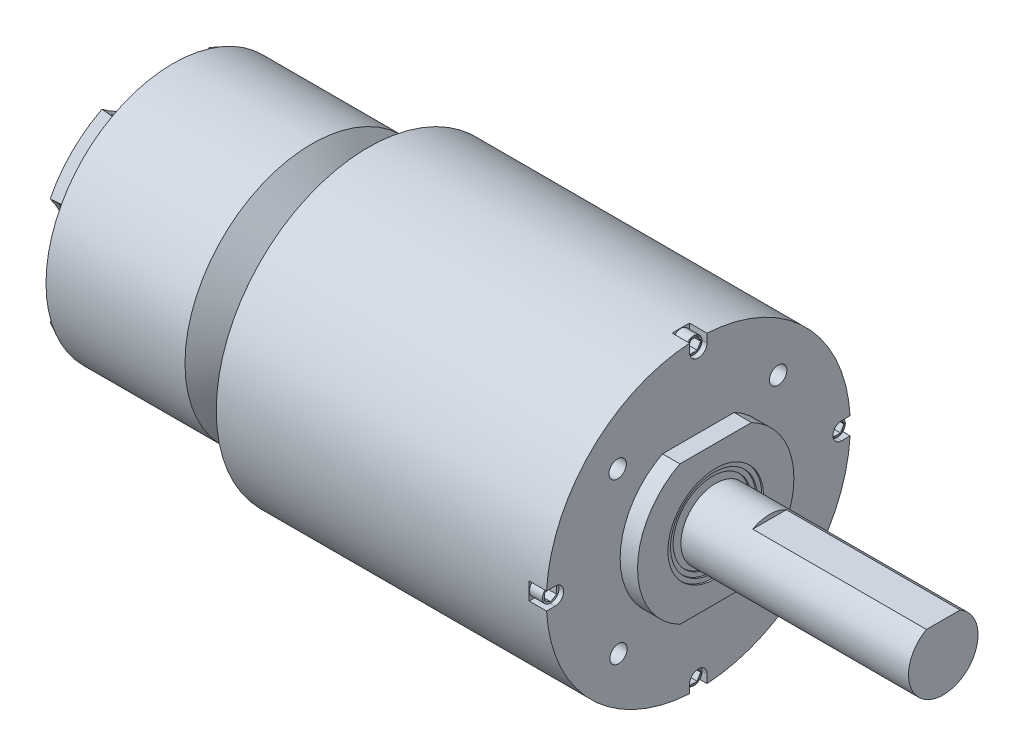
from build123d import *
from build123d.topology import SkipClean

# Parameters (mm, degrees)
BOSS_EXTRUDE1_DEPTH = 2
SKETCH6_R           = 4.5
CUT_EXTRUDE7_DEPTH  = 0.6
SKETCH8_R           = 5
CUT_EXTRUDE8_DEPTH  = 0.4
SKETCH9_R           = 5.5
CUT_EXTRUDE9_DEPTH  = 0.2
CUT_EXTRUDE11_DEPTH = 20
SKETCH11_R          = 1
CUT_EXTRUDE13_DEPTH = 4
CIRPATTERN2_COUNT   = 4
CUT_EXTRUDE20_DEPTH = 4
SKETCH13_R          = 0.95
BOSS_EXTRUDE2_DEPTH = 3.5
CUT_EXTRUDE21_DEPTH = 1
FILLET2_R           = 0.05
BOSS_EXTRUDE7_DEPTH = 2
CUT_EXTRUDE23_DEPTH = 2
SKETCH17_R          = 0.95
BOSS_EXTRUDE8_DEPTH = 1.5
SKETCH18_R          = 0.8
CUT_EXTRUDE24_DEPTH = 1
SKETCH20_R          = 0.8
BOSS_EXTRUDE9_DEPTH = 1
CUT_EXTRUDE27_DEPTH = 1
FILLET3_R           = 0.05
SKETCH22_R          = 10
CUT_EXTRUDE28_DEPTH = 2
SKETCH23_R          = 1
CUT_EXTRUDE29_DEPTH = 2


with BuildPart() as part:
    # Sketch1 → Revolve2 (revolve)
    with BuildSketch(Plane.XY, mode=Mode.PRIVATE) as revolve2_sk:
        Polygon((0, 1.6), (0, 0), (3, 0), (3, 13.6), (20, 13.6), (23.176928962, 9.6), (23.176928962, 0), (26, 0), (26.5, 0), (26.5, 1.6), (26, 1.6), (26, 4), (24, 4), (24, 9.6), (20, 14.6), (4, 14.6), (2, 13.6), (2, 5.6), (1, 5.6), (1, 1.6), align=None)
        Polygon((26.5, 1.6), (26.5, 0), (27.5, 0), (28, 0), (28, 16), (63, 16), (63, 0), (92.7, 0), (92.7, 4), (66.7, 4), (66.5, 4), (66.5, 5), (66.5, 5.6), (64.5, 5.6), (64.5, 17.5), (26.5, 17.5), align=None)
    revolve(revolve2_sk.sketch.rotate(Axis((0, 0, 0), (1, 0, 0)), 90), axis=Axis((0, 0, 0), (1, 0, 0)))

    # Sketch5 → Boss-Extrude1 (add)
    with BuildSketch(Plane(origin=(64.5, 0, 0), x_dir=(0, 0, -1), z_dir=(1, 0, 0))):
        with BuildLine():
            Line((0, 8), (0, 5.6))
            ThreePointArc((0, 5.6), (3.959797975, 3.959797975), (5.6, 0))
            ThreePointArc((5.6, 0), (3.959797975, -3.959797975), (0, -5.6))
            Line((0, -5.6), (0, -8))
            Line((0, -8), (4.123105626, -8))
            ThreePointArc((4.123105626, -8), (9, 0), (4.123105626, 8))
            Line((4.123105626, 8), (0, 8))
        make_face()
        with BuildLine():
            ThreePointArc((0, -5.6), (-5.6, 0), (0, 5.6))
            Line((0, 5.6), (0, 8))
            Line((0, 8), (-4.123105626, 8))
            ThreePointArc((-4.123105626, 8), (-9, 0), (-4.123105626, -8))
            Line((-4.123105626, -8), (0, -8))
            Line((0, -8), (0, -5.6))
        make_face()
    extrude(amount=BOSS_EXTRUDE1_DEPTH)

    # Sketch6 → Cut-Extrude7 (cut)
    with BuildSketch(Plane(origin=(66.5, 0, 0), x_dir=(0, 0, -1), z_dir=(1, 0, 0))):
        Circle(SKETCH6_R)
    extrude(amount=-CUT_EXTRUDE7_DEPTH, mode=Mode.SUBTRACT)


with BuildPart() as cut_extrude7_piece_1:
    # of the separate pieces the step leaves, piece 1, a body of its own (cut_extrude7_pieces)
    add(part.part.solids().sort_by_distance((66.5, -8, -4.123105626))[0])

    # Sketch8 → Cut-Extrude8 (cut)
    with BuildSketch(Plane(origin=(66.5, 0, 0), x_dir=(0, 0, -1), z_dir=(1, 0, 0))):
        Circle(SKETCH8_R)
    extrude(amount=-CUT_EXTRUDE8_DEPTH, mode=Mode.SUBTRACT)

    # Sketch9 → Cut-Extrude9 (cut)
    with BuildSketch(Plane(origin=(66.5, 0, 0), x_dir=(0, 0, -1), z_dir=(1, 0, 0))):
        Circle(SKETCH9_R)
    extrude(amount=-CUT_EXTRUDE9_DEPTH, mode=Mode.SUBTRACT)

    # Sketch11 → Cut-Extrude13 (cut)
    with BuildSketch(Plane(origin=(64.5, 0, 0), x_dir=(0, 0, -1), z_dir=(1, 0, 0))):
        with Locations((9.192388155, 9.192388155)):
            Circle(SKETCH11_R)
    cut_extrude13 = extrude(amount=-CUT_EXTRUDE13_DEPTH, mode=Mode.SUBTRACT)

    # CirPattern2: Cut-Extrude13 ×4 about axis
    cirpattern2_axis = Axis((0, -0.098886495, 0), (1, 0, 0))
    for i in range(1, CIRPATTERN2_COUNT):
        add(cut_extrude13.rotate(cirpattern2_axis, i * 360 / CIRPATTERN2_COUNT), mode=Mode.SUBTRACT)

    # Sketch12 → Cut-Extrude20 (cut)
    with BuildSketch(Plane(origin=(64.5, 0, 0), x_dir=(0, 0, -1), z_dir=(1, 0, 0))):
        with BuildLine():
            Line((-1, 17.47140521), (-1, 16.5))
            ThreePointArc((-1, 16.5), (0, 15.5), (1, 16.5))
            Line((1, 16.5), (1, 17.47140521))
            ThreePointArc((1, 17.47140521), (0, 17.5), (-1, 17.47140521))
        make_face()
    extrude(amount=-CUT_EXTRUDE20_DEPTH, mode=Mode.SUBTRACT)

    # Sketch13 → Boss-Extrude2 (add)
    with BuildSketch(Plane(origin=(60.5, 0, 0), x_dir=(0, 0, -1), z_dir=(1, 0, 0))):
        with Locations(Location((0, 16.5, 0), (0, 0, 213.170285224))):
            Circle(SKETCH13_R)
    extrude(amount=BOSS_EXTRUDE2_DEPTH)

    # Sketch14 → Cut-Extrude21 (cut)
    with BuildSketch(Plane(origin=(64, 0, 0), x_dir=(0, 0, -1), z_dir=(1, 0, 0))):
        Polygon((-0.4, 17.192820323), (0.4, 17.192820323), (0.8, 16.5), (0.4, 15.807179677), (-0.4, 15.807179677), (-0.8, 16.5), align=None)
    extrude(amount=-CUT_EXTRUDE21_DEPTH, mode=Mode.SUBTRACT)

    # Fillet2
    fillet2_edges = [cut_extrude7_piece_1.edges().sort_by_distance(p)[0] for p in [
        (64, 17.019772727, -0.79519577),
        (64, 16.846410162, 0.6),
        (64, 16.153589838, 0.6),
        (64, 15.807179677, 0),
        (64, 16.153589838, -0.6),
        (64, 16.846410162, -0.6),
        (64, 17.192820323, 0),
    ]]
    fillet(fillet2_edges, radius=FILLET2_R)

    # Sketch15 → Boss-Extrude7 (add)
    with SkipClean():  # the faces are left unmerged after this step: merging them gives an invalid solid
        with BuildSketch(Plane(origin=(60.5, 0, 0), x_dir=(0, 0, -1), z_dir=(1, 0, 0))):
            with BuildLine():
                Line((-1, 17.47140521), (-1, 16.5))
                ThreePointArc((-1, 16.5), (-0.96241882, 16.22843046), (-0.85249997, 15.977272727))
                ThreePointArc((-0.85249997, 15.977272727), (-0.823849194, 15.978775689), (-0.79519577, 15.980227273))
                ThreePointArc((-0.79519577, 15.980227273), (0, 17.45), (0.79519577, 15.980227273))
                ThreePointArc((0.79519577, 15.980227273), (0.823849194, 15.978775689), (0.85249997, 15.977272727))
                ThreePointArc((0.85249997, 15.977272727), (0.96241882, 16.22843046), (1, 16.5))
                Line((1, 16.5), (1, 17.47140521))
                ThreePointArc((1, 17.47140521), (0, 17.5), (-1, 17.47140521))
            make_face()
        extrude(amount=BOSS_EXTRUDE7_DEPTH)

    # Sketch16 → Cut-Extrude23 (cut)
    with SkipClean():  # the faces are left unmerged after this step: merging them gives an invalid solid
        with BuildSketch(Plane(origin=(64.5, 0, 0), x_dir=(0, 0, -1), z_dir=(1, 0, 0))):
            with BuildLine():
                ThreePointArc((0.999540758, -16.46969697), (0, -16.5), (-0.999540758, -16.46969697))
                ThreePointArc((-0.999540758, -16.46969697), (-0.999885183, -16.484846745), (-1, -16.5))
                Line((-1, -16.5), (-1, -17.47140521))
                ThreePointArc((-1, -17.47140521), (0, -17.5), (1, -17.47140521))
                Line((1, -17.47140521), (1, -16.5))
                ThreePointArc((1, -16.5), (0.999885183, -16.484846745), (0.999540758, -16.46969697))
            make_face()
            with BuildLine():
                ThreePointArc((0.999540758, -16.46969697), (0, -15.5), (-0.999540758, -16.46969697))
                ThreePointArc((-0.999540758, -16.46969697), (0, -16.5), (0.999540758, -16.46969697))
            make_face()
            with BuildLine():
                ThreePointArc((16.5, 1), (16.484846745, 0.999885183), (16.46969697, 0.999540758))
                ThreePointArc((16.46969697, 0.999540758), (16.492422502, 0.5), (16.5, 0))
                ThreePointArc((16.5, 0), (16.492422502, -0.5), (16.46969697, -0.999540758))
                ThreePointArc((16.46969697, -0.999540758), (16.484846745, -0.999885183), (16.5, -1))
                Line((16.5, -1), (17.47140521, -1))
                ThreePointArc((17.47140521, -1), (17.5, 0), (17.47140521, 1))
                Line((17.47140521, 1), (16.5, 1))
            make_face()
            with BuildLine():
                ThreePointArc((16.5, 0), (16.492422502, 0.5), (16.46969697, 0.999540758))
                ThreePointArc((16.46969697, 0.999540758), (15.5, 0), (16.46969697, -0.999540758))
                ThreePointArc((16.46969697, -0.999540758), (16.492422502, -0.5), (16.5, 0))
            make_face()
            with BuildLine():
                ThreePointArc((-16.46969697, 0.999540758), (-16.484846745, 0.999885183), (-16.5, 1))
                Line((-16.5, 1), (-17.47140521, 1))
                ThreePointArc((-17.47140521, 1), (-17.5, 0), (-17.47140521, -1))
                Line((-17.47140521, -1), (-16.5, -1))
                ThreePointArc((-16.5, -1), (-16.484846745, -0.999885183), (-16.46969697, -0.999540758))
                ThreePointArc((-16.46969697, -0.999540758), (-16.5, 0), (-16.46969697, 0.999540758))
            make_face()
            with BuildLine():
                ThreePointArc((-16.46969697, -0.999540758), (-15.5, 0), (-16.46969697, 0.999540758))
                ThreePointArc((-16.46969697, 0.999540758), (-16.5, 0), (-16.46969697, -0.999540758))
            make_face()
        extrude(amount=-CUT_EXTRUDE23_DEPTH, mode=Mode.SUBTRACT)

    # Sketch17 → Boss-Extrude8 (add)
    with SkipClean():  # the faces are left unmerged after this step: merging them gives an invalid solid
        with BuildSketch(Plane(origin=(62.5, 0, 0), x_dir=(0, 0, -1), z_dir=(1, 0, 0))):
            with Locations(Location((16.5, 0, 0), (0, 0, 123.170285224))):
                Circle(SKETCH17_R)
            with Locations(Location((0, -16.5, 0), (0, 0, 146.829714776))):
                Circle(SKETCH17_R)
            with Locations(Location((-16.5, 0, 0), (0, 0, 56.829714776))):
                Circle(SKETCH17_R)
        extrude(amount=BOSS_EXTRUDE8_DEPTH)

    # Sketch18 → Cut-Extrude24 (cut)
    with SkipClean():  # the faces are left unmerged after this step: merging them gives an invalid solid
        with BuildSketch(Plane(origin=(64, 0, 0), x_dir=(0, 0, -1), z_dir=(1, 0, 0))):
            with Locations((16.5, 0)):
                Circle(SKETCH18_R)
            with Locations((0, -16.5)):
                Circle(SKETCH18_R)
            Polygon((-17.192820323, 0.4), (-16.5, 0.8), (-15.807179677, 0.4), (-15.807179677, -0.4), (-16.5, -0.8), (-17.192820323, -0.4), align=None)
        extrude(amount=-CUT_EXTRUDE24_DEPTH, mode=Mode.SUBTRACT)

    # Sketch20 → Boss-Extrude9 (add)
    with SkipClean():  # the faces are left unmerged after this step: merging them gives an invalid solid
        with BuildSketch(Plane(origin=(63, 0, 0), x_dir=(0, 0, -1), z_dir=(1, 0, 0))):
            with Locations((0, -16.5)):
                Circle(SKETCH20_R)
            with Locations((16.5, 0)):
                Circle(SKETCH20_R)
        extrude(amount=BOSS_EXTRUDE9_DEPTH)

    # Sketch21 → Cut-Extrude27 (cut)
    with SkipClean():  # the faces are left unmerged after this step: merging them gives an invalid solid
        with BuildSketch(Plane(origin=(64, 0, 0), x_dir=(0, 0, -1), z_dir=(1, 0, 0))):
            Polygon((16.9, 0.692820323), (17.3, 0), (16.9, -0.692820323), (16.1, -0.692820323), (15.7, 0), (16.1, 0.692820323), align=None)
            Polygon((0.4, -17.192820323), (-0.4, -17.192820323), (-0.8, -16.5), (-0.4, -15.807179677), (0.4, -15.807179677), (0.8, -16.5), align=None)
        extrude(amount=-CUT_EXTRUDE27_DEPTH, mode=Mode.SUBTRACT)

    # Fillet3
    # the kernel refuses this fillet: 0.05 mm, written as the material it takes off along each edge
    with BuildSketch(Plane(origin=(64, 0, -16.5), x_dir=(0, 0.8370481785251175, 0.5471291865983601), z_dir=(0, 0.5471291865983601, -0.8370481785251175))) as fillet3_piece_1:
        with BuildLine():
            CenterArc((0.95 - FILLET3_R, -FILLET3_R), FILLET3_R, 0, 90)
            Line((0.95 - FILLET3_R, 0), (0.95, 0))
            Line((0.95, 0), (0.95, -FILLET3_R))
        make_face()
    revolve(axis=Axis((64, 0, -16.5), (1, 0, 0)), mode=Mode.SUBTRACT)
    with BuildSketch(Plane(origin=(64, -16.5, 0), x_dir=(0, 0.5471291865983604, 0.8370481785251173), z_dir=(0, 0.8370481785251173, -0.5471291865983604))) as fillet3_piece_2:
        with BuildLine():
            CenterArc((0.95 - FILLET3_R, -FILLET3_R), FILLET3_R, 0, 90)
            Line((0.95 - FILLET3_R, 0), (0.95, 0))
            Line((0.95, 0), (0.95, -FILLET3_R))
        make_face()
    revolve(axis=Axis((64, -16.5, 0), (1, 0, 0)), mode=Mode.SUBTRACT)
    with BuildSketch(Plane(origin=(64, 0.108253175, -17.3625), x_dir=(0, -0.5000000000000093, -0.8660254037844333), z_dir=(0, -0.8660254037844334, 0.5000000000000093))) as fillet3_piece_3_section:
        with BuildLine():
            CenterArc((FILLET3_R, -FILLET3_R), FILLET3_R, 90, 90)
            Line((0, -FILLET3_R), (0, 0))
            Line((0, 0), (FILLET3_R, 0))
        make_face()
    fillet3_piece_3 = extrude(amount=1.05, mode=Mode.PRIVATE)
    fillet3_piece_3 = split(fillet3_piece_3, bisect_by=Plane(origin=(63.988579525, -0.181567026, -17.404827771), z_dir=(0, -0.49999999999999506, 0.8660254037844415)), keep=Keep.TOP, mode=Mode.PRIVATE)
    fillet3_piece_3 = split(fillet3_piece_3, bisect_by=Plane(origin=(63.988579525, -0.692820323, -17.109655542), z_dir=(0, 1, 0)), keep=Keep.TOP, mode=Mode.PRIVATE)
    add(fillet3_piece_3, mode=Mode.SUBTRACT)
    with BuildSketch(Plane(origin=(64, 0.801073499, -16.8375), x_dir=(0, 0.499999999999995, -0.8660254037844415), z_dir=(0, -0.8660254037844415, -0.49999999999999506))) as fillet3_piece_4_section:
        with BuildLine():
            CenterArc((FILLET3_R, -FILLET3_R), FILLET3_R, 90, 90)
            Line((0, -FILLET3_R), (0, 0))
            Line((0, 0), (FILLET3_R, 0))
        make_face()
    fillet3_piece_4 = extrude(amount=1.05, mode=Mode.PRIVATE)
    fillet3_piece_4 = split(fillet3_piece_4, bisect_by=Plane(origin=(63.988579525, 0.692820323, -17.109655542), z_dir=(0, -1, 0)), keep=Keep.TOP, mode=Mode.PRIVATE)
    fillet3_piece_4 = split(fillet3_piece_4, bisect_by=Plane(origin=(63.988579525, 0.181567026, -17.404827771), z_dir=(0, 0.5000000000000093, 0.8660254037844334)), keep=Keep.TOP, mode=Mode.PRIVATE)
    add(fillet3_piece_4, mode=Mode.SUBTRACT)
    with BuildSketch(Plane(origin=(64, 0.692820323, -15.975), x_dir=(0, 1, 0), z_dir=(0, 0, -1))) as fillet3_piece_5_section:
        with BuildLine():
            CenterArc((FILLET3_R, -FILLET3_R), FILLET3_R, 90, 90)
            Line((0, -FILLET3_R), (0, 0))
            Line((0, 0), (FILLET3_R, 0))
        make_face()
    fillet3_piece_5 = extrude(amount=1.05, mode=Mode.PRIVATE)
    fillet3_piece_5 = split(fillet3_piece_5, bisect_by=Plane(origin=(63.988579525, 0.874387349, -16.795172229), z_dir=(0, -0.49999999999999506, 0.8660254037844415)), keep=Keep.TOP, mode=Mode.PRIVATE)
    fillet3_piece_5 = split(fillet3_piece_5, bisect_by=Plane(origin=(63.988579525, 0.874387349, -16.204827771), z_dir=(0, -0.5000000000000009, -0.8660254037844383)), keep=Keep.TOP, mode=Mode.PRIVATE)
    add(fillet3_piece_5, mode=Mode.SUBTRACT)
    with BuildSketch(Plane(origin=(64, -0.108253175, -15.6375), x_dir=(0, 0.5000000000000009, 0.8660254037844383), z_dir=(0, 0.8660254037844383, -0.5000000000000009))) as fillet3_piece_6_section:
        with BuildLine():
            CenterArc((FILLET3_R, -FILLET3_R), FILLET3_R, 90, 90)
            Line((0, -FILLET3_R), (0, 0))
            Line((0, 0), (FILLET3_R, 0))
        make_face()
    fillet3_piece_6 = extrude(amount=1.05, mode=Mode.PRIVATE)
    fillet3_piece_6 = split(fillet3_piece_6, bisect_by=Plane(origin=(63.988579525, 0.692820323, -15.890344458), z_dir=(0, -1, 0)), keep=Keep.TOP, mode=Mode.PRIVATE)
    fillet3_piece_6 = split(fillet3_piece_6, bisect_by=Plane(origin=(63.988579525, 0.181567026, -15.595172229), z_dir=(0, 0.4999999999999992, -0.8660254037844392)), keep=Keep.TOP, mode=Mode.PRIVATE)
    add(fillet3_piece_6, mode=Mode.SUBTRACT)
    with BuildSketch(Plane(origin=(64, -0.801073499, -16.1625), x_dir=(0, -0.4999999999999993, 0.8660254037844392), z_dir=(0, 0.8660254037844392, 0.4999999999999992))) as fillet3_piece_7_section:
        with BuildLine():
            CenterArc((FILLET3_R, -FILLET3_R), FILLET3_R, 90, 90)
            Line((0, -FILLET3_R), (0, 0))
            Line((0, 0), (FILLET3_R, 0))
        make_face()
    fillet3_piece_7 = extrude(amount=1.05, mode=Mode.PRIVATE)
    fillet3_piece_7 = split(fillet3_piece_7, bisect_by=Plane(origin=(63.988579525, -0.181567026, -15.595172229), z_dir=(0, -0.5000000000000009, -0.8660254037844383)), keep=Keep.TOP, mode=Mode.PRIVATE)
    fillet3_piece_7 = split(fillet3_piece_7, bisect_by=Plane(origin=(63.988579525, -0.692820323, -15.890344458), z_dir=(0, 1, 0)), keep=Keep.TOP, mode=Mode.PRIVATE)
    add(fillet3_piece_7, mode=Mode.SUBTRACT)
    with BuildSketch(Plane(origin=(64, -0.692820323, -17.025), x_dir=(0, -1, 0), z_dir=(0, 0, 1))) as fillet3_piece_8_section:
        with BuildLine():
            CenterArc((FILLET3_R, -FILLET3_R), FILLET3_R, 90, 90)
            Line((0, -FILLET3_R), (0, 0))
            Line((0, 0), (FILLET3_R, 0))
        make_face()
    fillet3_piece_8 = extrude(amount=1.05, mode=Mode.PRIVATE)
    fillet3_piece_8 = split(fillet3_piece_8, bisect_by=Plane(origin=(63.988579525, -0.874387349, -16.204827771), z_dir=(0, 0.4999999999999992, -0.8660254037844392)), keep=Keep.TOP, mode=Mode.PRIVATE)
    fillet3_piece_8 = split(fillet3_piece_8, bisect_by=Plane(origin=(63.988579525, -0.874387349, -16.795172229), z_dir=(0, 0.5000000000000093, 0.8660254037844334)), keep=Keep.TOP, mode=Mode.PRIVATE)
    add(fillet3_piece_8, mode=Mode.SUBTRACT)
    with BuildSketch(Plane(origin=(64, -16.608253175, 0.8625), x_dir=(0, 0.4999999999999983, 0.8660254037844397), z_dir=(0, 0.8660254037844397, -0.4999999999999983))) as fillet3_piece_9_section:
        with BuildLine():
            CenterArc((FILLET3_R, -FILLET3_R), FILLET3_R, 90, 90)
            Line((0, -FILLET3_R), (0, 0))
            Line((0, 0), (FILLET3_R, 0))
        make_face()
    fillet3_piece_9 = extrude(amount=1.05, mode=Mode.PRIVATE)
    fillet3_piece_9 = split(fillet3_piece_9, bisect_by=Plane(origin=(63.988579525, -15.807179677, 0.609655542), z_dir=(0, -1, 0)), keep=Keep.TOP, mode=Mode.PRIVATE)
    fillet3_piece_9 = split(fillet3_piece_9, bisect_by=Plane(origin=(63.988579525, -16.318432974, 0.904827771), z_dir=(0, 0.4999999999999978, -0.8660254037844399)), keep=Keep.TOP, mode=Mode.PRIVATE)
    add(fillet3_piece_9, mode=Mode.SUBTRACT)
    with BuildSketch(Plane(origin=(64, -17.301073499, 0.3375), x_dir=(0, -0.4999999999999978, 0.8660254037844398), z_dir=(0, 0.8660254037844399, 0.4999999999999978))) as fillet3_piece_10_section:
        with BuildLine():
            CenterArc((FILLET3_R, -FILLET3_R), FILLET3_R, 90, 90)
            Line((0, -FILLET3_R), (0, 0))
            Line((0, 0), (FILLET3_R, 0))
        make_face()
    fillet3_piece_10 = extrude(amount=1.05, mode=Mode.PRIVATE)
    fillet3_piece_10 = split(fillet3_piece_10, bisect_by=Plane(origin=(63.988579525, -16.681567026, 0.904827771), z_dir=(0, -0.4999999999999983, -0.8660254037844397)), keep=Keep.TOP, mode=Mode.PRIVATE)
    fillet3_piece_10 = split(fillet3_piece_10, bisect_by=Plane(origin=(63.988579525, -17.192820323, 0.609655542), z_dir=(0, 1, 0)), keep=Keep.TOP, mode=Mode.PRIVATE)
    add(fillet3_piece_10, mode=Mode.SUBTRACT)
    with BuildSketch(Plane(origin=(64, -17.192820323, -0.525), x_dir=(0, -1, 0), z_dir=(0, 0, 1))) as fillet3_piece_11_section:
        with BuildLine():
            CenterArc((FILLET3_R, -FILLET3_R), FILLET3_R, 90, 90)
            Line((0, -FILLET3_R), (0, 0))
            Line((0, 0), (FILLET3_R, 0))
        make_face()
    fillet3_piece_11 = extrude(amount=1.05, mode=Mode.PRIVATE)
    fillet3_piece_11 = split(fillet3_piece_11, bisect_by=Plane(origin=(63.988579525, -17.374387349, 0.295172229), z_dir=(0, 0.4999999999999978, -0.8660254037844399)), keep=Keep.TOP, mode=Mode.PRIVATE)
    fillet3_piece_11 = split(fillet3_piece_11, bisect_by=Plane(origin=(63.988579525, -17.374387349, -0.295172229), z_dir=(0, 0.49999999999999956, 0.8660254037844389)), keep=Keep.TOP, mode=Mode.PRIVATE)
    add(fillet3_piece_11, mode=Mode.SUBTRACT)
    with BuildSketch(Plane(origin=(64, -16.391746825, -0.8625), x_dir=(0, -0.4999999999999995, -0.8660254037844389), z_dir=(0, -0.8660254037844389, 0.49999999999999956))) as fillet3_piece_12_section:
        with BuildLine():
            CenterArc((FILLET3_R, -FILLET3_R), FILLET3_R, 90, 90)
            Line((0, -FILLET3_R), (0, 0))
            Line((0, 0), (FILLET3_R, 0))
        make_face()
    fillet3_piece_12 = extrude(amount=1.05, mode=Mode.PRIVATE)
    fillet3_piece_12 = split(fillet3_piece_12, bisect_by=Plane(origin=(63.988579525, -16.681567026, -0.904827771), z_dir=(0, -0.5000000000000001, 0.8660254037844386)), keep=Keep.TOP, mode=Mode.PRIVATE)
    fillet3_piece_12 = split(fillet3_piece_12, bisect_by=Plane(origin=(63.988579525, -17.192820323, -0.609655542), z_dir=(0, 1, 0)), keep=Keep.TOP, mode=Mode.PRIVATE)
    add(fillet3_piece_12, mode=Mode.SUBTRACT)
    with BuildSketch(Plane(origin=(64, -15.698926501, -0.3375), x_dir=(0, 0.5000000000000001, -0.8660254037844386), z_dir=(0, -0.8660254037844386, -0.5000000000000001))) as fillet3_piece_13_section:
        with BuildLine():
            CenterArc((FILLET3_R, -FILLET3_R), FILLET3_R, 90, 90)
            Line((0, -FILLET3_R), (0, 0))
            Line((0, 0), (FILLET3_R, 0))
        make_face()
    fillet3_piece_13 = extrude(amount=1.05, mode=Mode.PRIVATE)
    fillet3_piece_13 = split(fillet3_piece_13, bisect_by=Plane(origin=(63.988579525, -15.807179677, -0.609655542), z_dir=(0, -1, 0)), keep=Keep.TOP, mode=Mode.PRIVATE)
    fillet3_piece_13 = split(fillet3_piece_13, bisect_by=Plane(origin=(63.988579525, -16.318432974, -0.904827771), z_dir=(0, 0.49999999999999956, 0.8660254037844389)), keep=Keep.TOP, mode=Mode.PRIVATE)
    add(fillet3_piece_13, mode=Mode.SUBTRACT)
    with BuildSketch(Plane(origin=(64, -15.807179677, 0.525), x_dir=(0, 1, 0), z_dir=(0, 0, -1))) as fillet3_piece_14_section:
        with BuildLine():
            CenterArc((FILLET3_R, -FILLET3_R), FILLET3_R, 90, 90)
            Line((0, -FILLET3_R), (0, 0))
            Line((0, 0), (FILLET3_R, 0))
        make_face()
    fillet3_piece_14 = extrude(amount=1.05, mode=Mode.PRIVATE)
    fillet3_piece_14 = split(fillet3_piece_14, bisect_by=Plane(origin=(63.988579525, -15.625612651, -0.295172229), z_dir=(0, -0.5000000000000001, 0.8660254037844386)), keep=Keep.TOP, mode=Mode.PRIVATE)
    fillet3_piece_14 = split(fillet3_piece_14, bisect_by=Plane(origin=(63.988579525, -15.625612651, 0.295172229), z_dir=(0, -0.4999999999999983, -0.8660254037844397)), keep=Keep.TOP, mode=Mode.PRIVATE)
    add(fillet3_piece_14, mode=Mode.SUBTRACT)
    with BuildSketch(Plane(origin=(64, 0.801073499, -16.8375), x_dir=(0, 0.499999999999995, -0.8660254037844415), z_dir=(0, -0.8660254037844415, -0.49999999999999506))) as fillet3_piece_15a_section:
        with BuildLine():
            CenterArc((FILLET3_R, -FILLET3_R), FILLET3_R, 90, 90)
            Line((0, -FILLET3_R), (0, 0))
            Line((0, 0), (FILLET3_R, 0))
        make_face()
    fillet3_piece_15a = extrude(amount=1.05, mode=Mode.PRIVATE)
    fillet3_piece_15a = split(fillet3_piece_15a, bisect_by=Plane(origin=(63.988981528, -0.016712239, -17.290351184), z_dir=(0, -0.5000000000000093, -0.8660254037844334)), keep=Keep.TOP, mode=Mode.PRIVATE)
    with BuildSketch(Plane(origin=(64, 0.108253175, -17.3625), x_dir=(0, -0.5000000000000093, -0.8660254037844333), z_dir=(0, -0.8660254037844334, 0.5000000000000093))) as fillet3_piece_15b_section:
        with BuildLine():
            CenterArc((FILLET3_R, -FILLET3_R), FILLET3_R, 90, 90)
            Line((0, -FILLET3_R), (0, 0))
            Line((0, 0), (FILLET3_R, 0))
        make_face()
    fillet3_piece_15b = extrude(amount=1.05, mode=Mode.PRIVATE)
    fillet3_piece_15b = split(fillet3_piece_15b, bisect_by=Plane(origin=(63.988981528, 0.016712239, -17.290351184), z_dir=(0, 0.49999999999999506, -0.8660254037844415)), keep=Keep.TOP, mode=Mode.PRIVATE)
    fillet3_piece_15 = fillet3_piece_15a & fillet3_piece_15b
    add(fillet3_piece_15, mode=Mode.SUBTRACT)
    with BuildSketch(Plane(origin=(64, -0.692820323, -17.025), x_dir=(0, -1, 0), z_dir=(0, 0, 1))) as fillet3_piece_16a_section:
        with BuildLine():
            CenterArc((FILLET3_R, -FILLET3_R), FILLET3_R, 90, 90)
            Line((0, -FILLET3_R), (0, 0))
            Line((0, 0), (FILLET3_R, 0))
        make_face()
    fillet3_piece_16a = extrude(amount=1.05, mode=Mode.PRIVATE)
    fillet3_piece_16a = split(fillet3_piece_16a, bisect_by=Plane(origin=(63.988981528, -0.676108084, -16.909648816), z_dir=(0, -0.5000000000000093, -0.8660254037844334)), keep=Keep.TOP, mode=Mode.PRIVATE)
    with BuildSketch(Plane(origin=(64, 0.108253175, -17.3625), x_dir=(0, -0.5000000000000093, -0.8660254037844333), z_dir=(0, -0.8660254037844334, 0.5000000000000093))) as fillet3_piece_16b_section:
        with BuildLine():
            CenterArc((FILLET3_R, -FILLET3_R), FILLET3_R, 90, 90)
            Line((0, -FILLET3_R), (0, 0))
            Line((0, 0), (FILLET3_R, 0))
        make_face()
    fillet3_piece_16b = extrude(amount=1.05, mode=Mode.PRIVATE)
    fillet3_piece_16b = split(fillet3_piece_16b, bisect_by=Plane(origin=(63.988981528, -0.692820323, -16.880702368), z_dir=(0, -1, 0)), keep=Keep.TOP, mode=Mode.PRIVATE)
    fillet3_piece_16 = fillet3_piece_16a & fillet3_piece_16b
    add(fillet3_piece_16, mode=Mode.SUBTRACT)
    with BuildSketch(Plane(origin=(64, 0.801073499, -16.8375), x_dir=(0, 0.499999999999995, -0.8660254037844415), z_dir=(0, -0.8660254037844415, -0.49999999999999506))) as fillet3_piece_17a_section:
        with BuildLine():
            CenterArc((FILLET3_R, -FILLET3_R), FILLET3_R, 90, 90)
            Line((0, -FILLET3_R), (0, 0))
            Line((0, 0), (FILLET3_R, 0))
        make_face()
    fillet3_piece_17a = extrude(amount=1.05, mode=Mode.PRIVATE)
    fillet3_piece_17a = split(fillet3_piece_17a, bisect_by=Plane(origin=(63.988981528, 0.692820323, -16.880702368), z_dir=(0, 1, 0)), keep=Keep.TOP, mode=Mode.PRIVATE)
    with BuildSketch(Plane(origin=(64, 0.692820323, -15.975), x_dir=(0, 1, 0), z_dir=(0, 0, -1))) as fillet3_piece_17b_section:
        with BuildLine():
            CenterArc((FILLET3_R, -FILLET3_R), FILLET3_R, 90, 90)
            Line((0, -FILLET3_R), (0, 0))
            Line((0, 0), (FILLET3_R, 0))
        make_face()
    fillet3_piece_17b = extrude(amount=1.05, mode=Mode.PRIVATE)
    fillet3_piece_17b = split(fillet3_piece_17b, bisect_by=Plane(origin=(63.988981528, 0.676108084, -16.909648816), z_dir=(0, 0.49999999999999506, -0.8660254037844415)), keep=Keep.TOP, mode=Mode.PRIVATE)
    fillet3_piece_17 = fillet3_piece_17a & fillet3_piece_17b
    add(fillet3_piece_17, mode=Mode.SUBTRACT)
    with BuildSketch(Plane(origin=(64, 0.692820323, -15.975), x_dir=(0, 1, 0), z_dir=(0, 0, -1))) as fillet3_piece_18a_section:
        with BuildLine():
            CenterArc((FILLET3_R, -FILLET3_R), FILLET3_R, 90, 90)
            Line((0, -FILLET3_R), (0, 0))
            Line((0, 0), (FILLET3_R, 0))
        make_face()
    fillet3_piece_18a = extrude(amount=1.05, mode=Mode.PRIVATE)
    fillet3_piece_18a = split(fillet3_piece_18a, bisect_by=Plane(origin=(63.988981528, 0.676108084, -16.090351184), z_dir=(0, 0.5000000000000009, 0.8660254037844383)), keep=Keep.TOP, mode=Mode.PRIVATE)
    with BuildSketch(Plane(origin=(64, -0.108253175, -15.6375), x_dir=(0, 0.5000000000000009, 0.8660254037844383), z_dir=(0, 0.8660254037844383, -0.5000000000000009))) as fillet3_piece_18b_section:
        with BuildLine():
            CenterArc((FILLET3_R, -FILLET3_R), FILLET3_R, 90, 90)
            Line((0, -FILLET3_R), (0, 0))
            Line((0, 0), (FILLET3_R, 0))
        make_face()
    fillet3_piece_18b = extrude(amount=1.05, mode=Mode.PRIVATE)
    fillet3_piece_18b = split(fillet3_piece_18b, bisect_by=Plane(origin=(63.988981528, 0.692820323, -16.119297632), z_dir=(0, 1, 0)), keep=Keep.TOP, mode=Mode.PRIVATE)
    fillet3_piece_18 = fillet3_piece_18a & fillet3_piece_18b
    add(fillet3_piece_18, mode=Mode.SUBTRACT)
    with BuildSketch(Plane(origin=(64, -0.108253175, -15.6375), x_dir=(0, 0.5000000000000009, 0.8660254037844383), z_dir=(0, 0.8660254037844383, -0.5000000000000009))) as fillet3_piece_19a_section:
        with BuildLine():
            CenterArc((FILLET3_R, -FILLET3_R), FILLET3_R, 90, 90)
            Line((0, -FILLET3_R), (0, 0))
            Line((0, 0), (FILLET3_R, 0))
        make_face()
    fillet3_piece_19a = extrude(amount=1.05, mode=Mode.PRIVATE)
    fillet3_piece_19a = split(fillet3_piece_19a, bisect_by=Plane(origin=(63.988981528, -0.016712239, -15.709648816), z_dir=(0, -0.4999999999999992, 0.8660254037844392)), keep=Keep.TOP, mode=Mode.PRIVATE)
    with BuildSketch(Plane(origin=(64, -0.801073499, -16.1625), x_dir=(0, -0.4999999999999993, 0.8660254037844392), z_dir=(0, 0.8660254037844392, 0.4999999999999992))) as fillet3_piece_19b_section:
        with BuildLine():
            CenterArc((FILLET3_R, -FILLET3_R), FILLET3_R, 90, 90)
            Line((0, -FILLET3_R), (0, 0))
            Line((0, 0), (FILLET3_R, 0))
        make_face()
    fillet3_piece_19b = extrude(amount=1.05, mode=Mode.PRIVATE)
    fillet3_piece_19b = split(fillet3_piece_19b, bisect_by=Plane(origin=(63.988981528, 0.016712239, -15.709648816), z_dir=(0, 0.5000000000000009, 0.8660254037844383)), keep=Keep.TOP, mode=Mode.PRIVATE)
    fillet3_piece_19 = fillet3_piece_19a & fillet3_piece_19b
    add(fillet3_piece_19, mode=Mode.SUBTRACT)
    with BuildSketch(Plane(origin=(64, -0.801073499, -16.1625), x_dir=(0, -0.4999999999999993, 0.8660254037844392), z_dir=(0, 0.8660254037844392, 0.4999999999999992))) as fillet3_piece_20a_section:
        with BuildLine():
            CenterArc((FILLET3_R, -FILLET3_R), FILLET3_R, 90, 90)
            Line((0, -FILLET3_R), (0, 0))
            Line((0, 0), (FILLET3_R, 0))
        make_face()
    fillet3_piece_20a = extrude(amount=1.05, mode=Mode.PRIVATE)
    fillet3_piece_20a = split(fillet3_piece_20a, bisect_by=Plane(origin=(63.988981528, -0.692820323, -16.119297632), z_dir=(0, -1, 0)), keep=Keep.TOP, mode=Mode.PRIVATE)
    with BuildSketch(Plane(origin=(64, -0.692820323, -17.025), x_dir=(0, -1, 0), z_dir=(0, 0, 1))) as fillet3_piece_20b_section:
        with BuildLine():
            CenterArc((FILLET3_R, -FILLET3_R), FILLET3_R, 90, 90)
            Line((0, -FILLET3_R), (0, 0))
            Line((0, 0), (FILLET3_R, 0))
        make_face()
    fillet3_piece_20b = extrude(amount=1.05, mode=Mode.PRIVATE)
    fillet3_piece_20b = split(fillet3_piece_20b, bisect_by=Plane(origin=(63.988981528, -0.676108084, -16.090351184), z_dir=(0, -0.4999999999999992, 0.8660254037844392)), keep=Keep.TOP, mode=Mode.PRIVATE)
    fillet3_piece_20 = fillet3_piece_20a & fillet3_piece_20b
    add(fillet3_piece_20, mode=Mode.SUBTRACT)
    with BuildSketch(Plane(origin=(64, -16.608253175, 0.8625), x_dir=(0, 0.4999999999999983, 0.8660254037844397), z_dir=(0, 0.8660254037844397, -0.4999999999999983))) as fillet3_piece_21a_section:
        with BuildLine():
            CenterArc((FILLET3_R, -FILLET3_R), FILLET3_R, 90, 90)
            Line((0, -FILLET3_R), (0, 0))
            Line((0, 0), (FILLET3_R, 0))
        make_face()
    fillet3_piece_21a = extrude(amount=1.05, mode=Mode.PRIVATE)
    fillet3_piece_21a = split(fillet3_piece_21a, bisect_by=Plane(origin=(63.988981528, -16.516712239, 0.790351184), z_dir=(0, -0.4999999999999978, 0.8660254037844399)), keep=Keep.TOP, mode=Mode.PRIVATE)
    with BuildSketch(Plane(origin=(64, -17.301073499, 0.3375), x_dir=(0, -0.4999999999999978, 0.8660254037844398), z_dir=(0, 0.8660254037844399, 0.4999999999999978))) as fillet3_piece_21b_section:
        with BuildLine():
            CenterArc((FILLET3_R, -FILLET3_R), FILLET3_R, 90, 90)
            Line((0, -FILLET3_R), (0, 0))
            Line((0, 0), (FILLET3_R, 0))
        make_face()
    fillet3_piece_21b = extrude(amount=1.05, mode=Mode.PRIVATE)
    fillet3_piece_21b = split(fillet3_piece_21b, bisect_by=Plane(origin=(63.988981528, -16.483287761, 0.790351184), z_dir=(0, 0.4999999999999983, 0.8660254037844397)), keep=Keep.TOP, mode=Mode.PRIVATE)
    fillet3_piece_21 = fillet3_piece_21a & fillet3_piece_21b
    add(fillet3_piece_21, mode=Mode.SUBTRACT)
    with BuildSketch(Plane(origin=(64, -15.807179677, 0.525), x_dir=(0, 1, 0), z_dir=(0, 0, -1))) as fillet3_piece_22a_section:
        with BuildLine():
            CenterArc((FILLET3_R, -FILLET3_R), FILLET3_R, 90, 90)
            Line((0, -FILLET3_R), (0, 0))
            Line((0, 0), (FILLET3_R, 0))
        make_face()
    fillet3_piece_22a = extrude(amount=1.05, mode=Mode.PRIVATE)
    fillet3_piece_22a = split(fillet3_piece_22a, bisect_by=Plane(origin=(63.988981528, -15.823891916, 0.409648816), z_dir=(0, 0.4999999999999983, 0.8660254037844397)), keep=Keep.TOP, mode=Mode.PRIVATE)
    with BuildSketch(Plane(origin=(64, -16.608253175, 0.8625), x_dir=(0, 0.4999999999999983, 0.8660254037844397), z_dir=(0, 0.8660254037844397, -0.4999999999999983))) as fillet3_piece_22b_section:
        with BuildLine():
            CenterArc((FILLET3_R, -FILLET3_R), FILLET3_R, 90, 90)
            Line((0, -FILLET3_R), (0, 0))
            Line((0, 0), (FILLET3_R, 0))
        make_face()
    fillet3_piece_22b = extrude(amount=1.05, mode=Mode.PRIVATE)
    fillet3_piece_22b = split(fillet3_piece_22b, bisect_by=Plane(origin=(63.988981528, -15.807179677, 0.380702368), z_dir=(0, 1, 0)), keep=Keep.TOP, mode=Mode.PRIVATE)
    fillet3_piece_22 = fillet3_piece_22a & fillet3_piece_22b
    add(fillet3_piece_22, mode=Mode.SUBTRACT)
    with BuildSketch(Plane(origin=(64, -17.301073499, 0.3375), x_dir=(0, -0.4999999999999978, 0.8660254037844398), z_dir=(0, 0.8660254037844399, 0.4999999999999978))) as fillet3_piece_23a_section:
        with BuildLine():
            CenterArc((FILLET3_R, -FILLET3_R), FILLET3_R, 90, 90)
            Line((0, -FILLET3_R), (0, 0))
            Line((0, 0), (FILLET3_R, 0))
        make_face()
    fillet3_piece_23a = extrude(amount=1.05, mode=Mode.PRIVATE)
    fillet3_piece_23a = split(fillet3_piece_23a, bisect_by=Plane(origin=(63.988981528, -17.192820323, 0.380702368), z_dir=(0, -1, 0)), keep=Keep.TOP, mode=Mode.PRIVATE)
    with BuildSketch(Plane(origin=(64, -17.192820323, -0.525), x_dir=(0, -1, 0), z_dir=(0, 0, 1))) as fillet3_piece_23b_section:
        with BuildLine():
            CenterArc((FILLET3_R, -FILLET3_R), FILLET3_R, 90, 90)
            Line((0, -FILLET3_R), (0, 0))
            Line((0, 0), (FILLET3_R, 0))
        make_face()
    fillet3_piece_23b = extrude(amount=1.05, mode=Mode.PRIVATE)
    fillet3_piece_23b = split(fillet3_piece_23b, bisect_by=Plane(origin=(63.988981528, -17.176108084, 0.409648816), z_dir=(0, -0.4999999999999978, 0.8660254037844399)), keep=Keep.TOP, mode=Mode.PRIVATE)
    fillet3_piece_23 = fillet3_piece_23a & fillet3_piece_23b
    add(fillet3_piece_23, mode=Mode.SUBTRACT)
    with BuildSketch(Plane(origin=(64, -17.192820323, -0.525), x_dir=(0, -1, 0), z_dir=(0, 0, 1))) as fillet3_piece_24a_section:
        with BuildLine():
            CenterArc((FILLET3_R, -FILLET3_R), FILLET3_R, 90, 90)
            Line((0, -FILLET3_R), (0, 0))
            Line((0, 0), (FILLET3_R, 0))
        make_face()
    fillet3_piece_24a = extrude(amount=1.05, mode=Mode.PRIVATE)
    fillet3_piece_24a = split(fillet3_piece_24a, bisect_by=Plane(origin=(63.988981528, -17.176108084, -0.409648816), z_dir=(0, -0.49999999999999956, -0.8660254037844389)), keep=Keep.TOP, mode=Mode.PRIVATE)
    with BuildSketch(Plane(origin=(64, -16.391746825, -0.8625), x_dir=(0, -0.4999999999999995, -0.8660254037844389), z_dir=(0, -0.8660254037844389, 0.49999999999999956))) as fillet3_piece_24b_section:
        with BuildLine():
            CenterArc((FILLET3_R, -FILLET3_R), FILLET3_R, 90, 90)
            Line((0, -FILLET3_R), (0, 0))
            Line((0, 0), (FILLET3_R, 0))
        make_face()
    fillet3_piece_24b = extrude(amount=1.05, mode=Mode.PRIVATE)
    fillet3_piece_24b = split(fillet3_piece_24b, bisect_by=Plane(origin=(63.988981528, -17.192820323, -0.380702368), z_dir=(0, -1, 0)), keep=Keep.TOP, mode=Mode.PRIVATE)
    fillet3_piece_24 = fillet3_piece_24a & fillet3_piece_24b
    add(fillet3_piece_24, mode=Mode.SUBTRACT)
    with BuildSketch(Plane(origin=(64, -15.698926501, -0.3375), x_dir=(0, 0.5000000000000001, -0.8660254037844386), z_dir=(0, -0.8660254037844386, -0.5000000000000001))) as fillet3_piece_25a_section:
        with BuildLine():
            CenterArc((FILLET3_R, -FILLET3_R), FILLET3_R, 90, 90)
            Line((0, -FILLET3_R), (0, 0))
            Line((0, 0), (FILLET3_R, 0))
        make_face()
    fillet3_piece_25a = extrude(amount=1.05, mode=Mode.PRIVATE)
    fillet3_piece_25a = split(fillet3_piece_25a, bisect_by=Plane(origin=(63.988981528, -16.516712239, -0.790351184), z_dir=(0, -0.49999999999999956, -0.8660254037844389)), keep=Keep.TOP, mode=Mode.PRIVATE)
    with BuildSketch(Plane(origin=(64, -16.391746825, -0.8625), x_dir=(0, -0.4999999999999995, -0.8660254037844389), z_dir=(0, -0.8660254037844389, 0.49999999999999956))) as fillet3_piece_25b_section:
        with BuildLine():
            CenterArc((FILLET3_R, -FILLET3_R), FILLET3_R, 90, 90)
            Line((0, -FILLET3_R), (0, 0))
            Line((0, 0), (FILLET3_R, 0))
        make_face()
    fillet3_piece_25b = extrude(amount=1.05, mode=Mode.PRIVATE)
    fillet3_piece_25b = split(fillet3_piece_25b, bisect_by=Plane(origin=(63.988981528, -16.483287761, -0.790351184), z_dir=(0, 0.5000000000000001, -0.8660254037844386)), keep=Keep.TOP, mode=Mode.PRIVATE)
    fillet3_piece_25 = fillet3_piece_25a & fillet3_piece_25b
    add(fillet3_piece_25, mode=Mode.SUBTRACT)
    with BuildSketch(Plane(origin=(64, -15.698926501, -0.3375), x_dir=(0, 0.5000000000000001, -0.8660254037844386), z_dir=(0, -0.8660254037844386, -0.5000000000000001))) as fillet3_piece_26a_section:
        with BuildLine():
            CenterArc((FILLET3_R, -FILLET3_R), FILLET3_R, 90, 90)
            Line((0, -FILLET3_R), (0, 0))
            Line((0, 0), (FILLET3_R, 0))
        make_face()
    fillet3_piece_26a = extrude(amount=1.05, mode=Mode.PRIVATE)
    fillet3_piece_26a = split(fillet3_piece_26a, bisect_by=Plane(origin=(63.988981528, -15.807179677, -0.380702368), z_dir=(0, 1, 0)), keep=Keep.TOP, mode=Mode.PRIVATE)
    with BuildSketch(Plane(origin=(64, -15.807179677, 0.525), x_dir=(0, 1, 0), z_dir=(0, 0, -1))) as fillet3_piece_26b_section:
        with BuildLine():
            CenterArc((FILLET3_R, -FILLET3_R), FILLET3_R, 90, 90)
            Line((0, -FILLET3_R), (0, 0))
            Line((0, 0), (FILLET3_R, 0))
        make_face()
    fillet3_piece_26b = extrude(amount=1.05, mode=Mode.PRIVATE)
    fillet3_piece_26b = split(fillet3_piece_26b, bisect_by=Plane(origin=(63.988981528, -15.823891916, -0.409648816), z_dir=(0, 0.5000000000000001, -0.8660254037844386)), keep=Keep.TOP, mode=Mode.PRIVATE)
    fillet3_piece_26 = fillet3_piece_26a & fillet3_piece_26b
    add(fillet3_piece_26, mode=Mode.SUBTRACT)

    # Sketch22 → Cut-Extrude28 (cut)
    with SkipClean():  # the faces are left unmerged after this step: merging them gives an invalid solid
        with BuildSketch(Plane.ZY.offset(-2)):
            with Locations((20, 0)):
                Circle(SKETCH22_R)
            with Locations((0, -20)):
                Circle(SKETCH22_R)
            with Locations((-20, 0)):
                Circle(SKETCH22_R)
            with Locations((0, 20)):
                Circle(SKETCH22_R)
        extrude(amount=-CUT_EXTRUDE28_DEPTH, mode=Mode.SUBTRACT)

    # Sketch23 → Cut-Extrude29 (cut)
    with SkipClean():  # the faces are left unmerged after this step: merging them gives an invalid solid
        with BuildSketch(Plane.ZY.offset(-2)):
            with Locations((-5.656854249, 5.656854249)):
                Circle(SKETCH23_R)
            with Locations((6.717514421, 6.717514421)):
                Circle(SKETCH23_R)
            with Locations((5.656854249, -5.656854249)):
                Circle(SKETCH23_R)
            with Locations((-6.717514421, -6.717514421)):
                Circle(SKETCH23_R)
        extrude(amount=-CUT_EXTRUDE29_DEPTH, mode=Mode.SUBTRACT)


with BuildPart() as cut_extrude7_piece_2:
    # of the separate pieces the step leaves, piece 2, a body of its own (cut_extrude7_pieces)
    add(part.part.solids().sort_by_distance((92.7, 0, 4))[0])

    # Sketch10 → Cut-Extrude11 (cut)
    with BuildSketch(Plane(origin=(92.7, 0, 0), x_dir=(0, 0, -1), z_dir=(1, 0, 0))):
        with BuildLine():
            Line((1.936491673, 3.5), (-1.936491673, 3.5))
            ThreePointArc((-1.936491673, 3.5), (0, 4), (1.936491673, 3.5))
        make_face()
    extrude(amount=-CUT_EXTRUDE11_DEPTH, mode=Mode.SUBTRACT)


solid = Compound([cut_extrude7_piece_1.part, cut_extrude7_piece_2.part])
